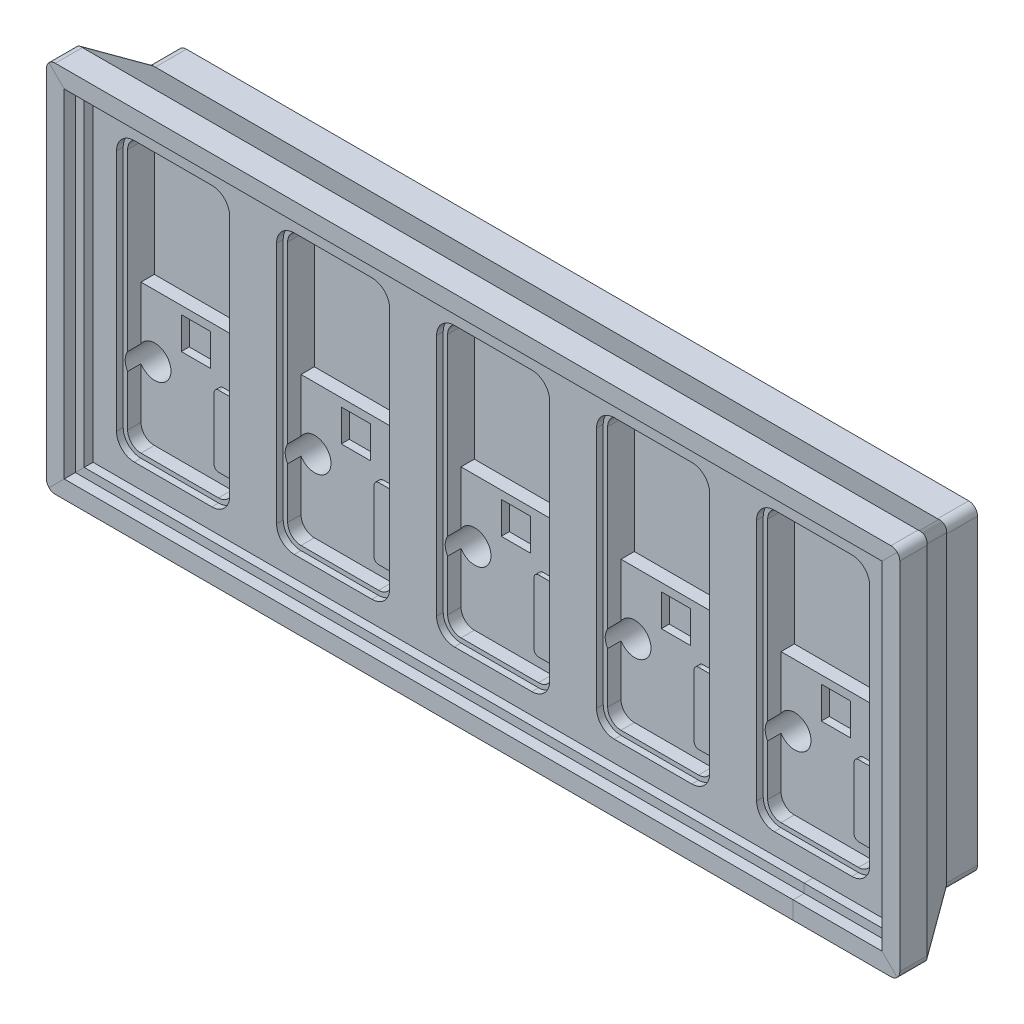
from build123d import *

# Parameters (mm, degrees)
SKIZZE1_W                         = 36
SKIZZE1_H                         = 72
AUFSATZ_LINEAR_AUSTRAGEN1_DEPTH   = 19
SCHNITT_LINEAR_AUSTRAGEN1_DEPTH   = 1.5
SCHNITT_LINEAR_AUSTRAGEN2_DEPTH   = 3
SCHNITT_LINEAR_AUSTRAGEN3_DEPTH   = 3
SKIZZE5_R                         = 3.65
SCHNITT_LINEAR_AUSTRAGEN4_DEPTH   = 15.5
SKIZZE6_W                         = 6.6
SKIZZE6_H                         = 7.2
SCHNITT_LINEAR_AUSTRAGEN5_DEPTH   = 4.8
SKIZZE7_W                         = 6
SKIZZE7_H                         = 16
AUFSATZ_LINEAR_AUSTRAGEN2_DEPTH   = 1
VERRUNDUNG2_R                     = 1
LINEARES_MUSTER3_COUNT            = 5
LINEARES_MUSTER3_PITCH            = 36
VERRUNDUNG2_OF_LINEARES_MUSTER3_R = 1
VERRUNDUNG3_R                     = 2


with BuildPart() as part:
    # Skizze1 → Aufsatz-Linear austragen1 (new body)
    with BuildSketch(Plane.XY):
        Rectangle(SKIZZE1_W, SKIZZE1_H)
    aufsatz_linear_austragen1 = extrude(amount=AUFSATZ_LINEAR_AUSTRAGEN1_DEPTH)

    # Skizze2 → Schnitt-Linear austragen1 (cut)
    with BuildSketch(Plane.XY.offset(19)):
        with BuildLine():
            Line((-8.725, -31.325), (8.725, -31.325))
            ThreePointArc((8.725, -31.325), (11.553427125, -30.153427125), (12.725, -27.325))
            Line((12.725, -27.325), (12.725, 27.325))
            ThreePointArc((12.725, 27.325), (11.553427125, 30.153427125), (8.725, 31.325))
            Line((8.725, 31.325), (-8.725, 31.325))
            ThreePointArc((-8.725, 31.325), (-11.553427125, 30.153427125), (-12.725, 27.325))
            Line((-12.725, 27.325), (-12.725, -27.325))
            ThreePointArc((-12.725, -27.325), (-11.553427125, -30.153427125), (-8.725, -31.325))
        make_face()
    schnitt_linear_austragen1 = extrude(amount=-SCHNITT_LINEAR_AUSTRAGEN1_DEPTH, mode=Mode.SUBTRACT)

    # Skizze3 → Schnitt-Linear austragen2 (cut)
    with BuildSketch(Plane.XY.offset(17.5)):
        with BuildLine():
            Line((-8.725, -30.325), (8.725, -30.325))
            ThreePointArc((8.725, -30.325), (10.846320344, -29.446320344), (11.725, -27.325))
            Line((11.725, -27.325), (11.725, 27.325))
            ThreePointArc((11.725, 27.325), (10.846320344, 29.446320344), (8.725, 30.325))
            Line((8.725, 30.325), (-8.725, 30.325))
            ThreePointArc((-8.725, 30.325), (-10.846320344, 29.446320344), (-11.725, 27.325))
            Line((-11.725, 27.325), (-11.725, -27.325))
            ThreePointArc((-11.725, -27.325), (-10.846320344, -29.446320344), (-8.725, -30.325))
        make_face()
    schnitt_linear_austragen2 = extrude(amount=-SCHNITT_LINEAR_AUSTRAGEN2_DEPTH, mode=Mode.SUBTRACT)

    # Skizze4 → Schnitt-Linear austragen3 (cut)
    with BuildSketch(Plane.XY.offset(14.5)):
        with BuildLine():
            Line((-11.725, 0), (11.725, 0))
            Line((11.725, 0), (11.725, 27.325))
            ThreePointArc((11.725, 27.325), (10.846320344, 29.446320344), (8.725, 30.325))
            Line((8.725, 30.325), (-8.725, 30.325))
            ThreePointArc((-8.725, 30.325), (-10.846320344, 29.446320344), (-11.725, 27.325))
            Line((-11.725, 27.325), (-11.725, 0))
        make_face()
    schnitt_linear_austragen3 = extrude(amount=-SCHNITT_LINEAR_AUSTRAGEN3_DEPTH, mode=Mode.SUBTRACT)

    # Skizze5 → Schnitt-Linear austragen4 (cut)
    with BuildSketch(Plane.XY.offset(17.5)):
        with Locations((-8.63, -13.97)):
            Circle(SKIZZE5_R)
    schnitt_linear_austragen4 = extrude(amount=-SCHNITT_LINEAR_AUSTRAGEN4_DEPTH, mode=Mode.SUBTRACT)

    # Skizze6 → Schnitt-Linear austragen5 (cut)
    with BuildSketch(Plane.XY.offset(17.5)):
        with Locations((0.64, -5.4)):
            Rectangle(SKIZZE6_W, SKIZZE6_H)
    schnitt_linear_austragen5 = extrude(amount=-SCHNITT_LINEAR_AUSTRAGEN5_DEPTH, mode=Mode.SUBTRACT)

    # Skizze7 → Aufsatz-Linear austragen2 (add)
    with BuildSketch(Plane.XY.offset(14.5)):
        with Locations((8.725, -19.325)):
            Rectangle(SKIZZE7_W, SKIZZE7_H)
    aufsatz_linear_austragen2 = extrude(amount=AUFSATZ_LINEAR_AUSTRAGEN2_DEPTH)

    # Verrundung2
    verrundung2_edges = [part.edges().sort_by_distance(p)[0] for p in [
        (11.725, -11.325, 15),
        (5.725, -11.325, 15),
        (5.725, -27.325, 15),
        (11.725, -27.325, 15),
    ]]
    fillet(verrundung2_edges, radius=VERRUNDUNG2_R)

    # Lineares Muster3: Aufsatz-Linear austragen1, Schnitt-Linear austragen1, Schnitt-Linear austragen2, Schnitt-Linear austragen3, Schnitt-Linear austragen4, Schnitt-Linear austragen5, Aufsatz-Linear austragen2 ×5
    with Locations(*[(-i * LINEARES_MUSTER3_PITCH, 0, 0) for i in range(1, LINEARES_MUSTER3_COUNT)]):
        add(aufsatz_linear_austragen1)
        add(schnitt_linear_austragen1, mode=Mode.SUBTRACT)
        add(schnitt_linear_austragen2, mode=Mode.SUBTRACT)
        add(schnitt_linear_austragen3, mode=Mode.SUBTRACT)
        add(schnitt_linear_austragen4, mode=Mode.SUBTRACT)
        add(schnitt_linear_austragen5, mode=Mode.SUBTRACT)
        add(aufsatz_linear_austragen2)

    # Verrundung2 of Lineares Muster3
    verrundung2_of_lineares_muster3_edges = [part.edges().sort_by_distance(p)[0] for p in [
        (-24.275, -11.325, 15),
        (-30.275, -11.325, 15),
        (-30.275, -27.325, 15),
        (-24.275, -27.325, 15),
        (-60.275, -11.325, 15),
        (-66.275, -11.325, 15),
        (-66.275, -27.325, 15),
        (-60.275, -27.325, 15),
        (-96.275, -11.325, 15),
        (-102.275, -11.325, 15),
        (-102.275, -27.325, 15),
        (-96.275, -27.325, 15),
        (-132.275, -11.325, 15),
        (-138.275, -11.325, 15),
        (-138.275, -27.325, 15),
        (-132.275, -27.325, 15),
    ]]
    fillet(verrundung2_of_lineares_muster3_edges, radius=VERRUNDUNG2_OF_LINEARES_MUSTER3_R)

    # Austragung1: sweep along a path in Skizze9
    with BuildLine(Plane.XY.offset(19)) as austragung1_path:
        Line((18, 36), (-162, 36))
        Line((-162, 36), (-162, -36))
        Line((-162, -36), (18, -36))
        Line((18, -36), (18, 36))
    # Skizze8 → Austragung1 (sweep)
    with BuildSketch(Plane(origin=(0, 0, 0), x_dir=(0, 0, -1), z_dir=(1, 0, 0))):
        Polygon((-7, -36), (-17.392304845, -42), (-23.5, -42), (-23.5, -38), (-21, -38), (-21, -36), (-19, -36), align=None)
    sweep(path=austragung1_path.line, transition=Transition.RIGHT)

    # Verrundung3
    # the kernel refuses this fillet: 2 mm, written as the material it takes off along each edge
    with BuildSketch(Plane(origin=(-162, -36, -5), x_dir=(0, 1, 0), z_dir=(0, 0, 1))) as verrundung3_piece_1_section:
        with BuildLine():
            CenterArc((VERRUNDUNG3_R, -VERRUNDUNG3_R), VERRUNDUNG3_R, 90, 90)
            Line((0, -VERRUNDUNG3_R), (0, 0))
            Line((0, 0), (VERRUNDUNG3_R, 0))
        make_face()
    verrundung3_piece_1 = extrude(amount=17, mode=Mode.PRIVATE)
    verrundung3_piece_1 = split(verrundung3_piece_1, bisect_by=Plane(origin=(-159.017907567, -35.559247483, 1.834864394), z_dir=(-0.8660254037844417, 0, -0.49999999999999484)), keep=Keep.TOP, mode=Mode.PRIVATE)
    verrundung3_piece_1 = split(verrundung3_piece_1, bisect_by=Plane(origin=(-161.559247483, -33.017907567, 1.834864394), z_dir=(0, -0.8660254037844418, -0.4999999999999947)), keep=Keep.TOP, mode=Mode.PRIVATE)
    add(verrundung3_piece_1, mode=Mode.SUBTRACT)
    with BuildSketch(Plane(origin=(-162, -36, -5), x_dir=(0, 1, 0), z_dir=(0, 0, 1))) as verrundung3_piece_2_section:
        with BuildLine():
            CenterArc((VERRUNDUNG3_R, -VERRUNDUNG3_R), VERRUNDUNG3_R, 90, 90)
            Line((0, -VERRUNDUNG3_R), (0, 0))
            Line((0, 0), (VERRUNDUNG3_R, 0))
        make_face()
    verrundung3_piece_2 = extrude(amount=17, mode=Mode.PRIVATE)
    verrundung3_piece_2 = split(verrundung3_piece_2, bisect_by=Plane(origin=(-161.306604123, -35.914036084, 5.799003111), z_dir=(0.8660254037844417, 0, 0.49999999999999484)), keep=Keep.TOP, mode=Mode.PRIVATE)
    verrundung3_piece_2 = split(verrundung3_piece_2, bisect_by=Plane(origin=(-160.942144946, -35.549576907, 6.219844318), z_dir=(0, -0.8660254037844418, -0.4999999999999947)), keep=Keep.TOP, mode=Mode.PRIVATE)
    add(verrundung3_piece_2, mode=Mode.SUBTRACT)
    with BuildSketch(Plane(origin=(-162, -36, -5), x_dir=(0, 1, 0), z_dir=(0, 0, 1))) as verrundung3_piece_3_section:
        with BuildLine():
            CenterArc((VERRUNDUNG3_R, -VERRUNDUNG3_R), VERRUNDUNG3_R, 90, 90)
            Line((0, -VERRUNDUNG3_R), (0, 0))
            Line((0, 0), (VERRUNDUNG3_R, 0))
        make_face()
    verrundung3_piece_3 = extrude(amount=17, mode=Mode.PRIVATE)
    verrundung3_piece_3 = split(verrundung3_piece_3, bisect_by=Plane(origin=(-161.549576907, -34.942144946, 6.219844318), z_dir=(-0.8660254037844417, 0, -0.49999999999999484)), keep=Keep.TOP, mode=Mode.PRIVATE)
    verrundung3_piece_3 = split(verrundung3_piece_3, bisect_by=Plane(origin=(-161.914036084, -35.306604123, 5.799003111), z_dir=(0, 0.8660254037844418, 0.4999999999999947)), keep=Keep.TOP, mode=Mode.PRIVATE)
    add(verrundung3_piece_3, mode=Mode.SUBTRACT)
    with BuildSketch(Plane(origin=(-162, 36, -5), x_dir=(1, 0, 0), z_dir=(0, 0, 1))) as verrundung3_piece_4_section:
        with BuildLine():
            CenterArc((VERRUNDUNG3_R, -VERRUNDUNG3_R), VERRUNDUNG3_R, 90, 90)
            Line((0, -VERRUNDUNG3_R), (0, 0))
            Line((0, 0), (VERRUNDUNG3_R, 0))
        make_face()
    verrundung3_piece_4 = extrude(amount=17, mode=Mode.PRIVATE)
    verrundung3_piece_4 = split(verrundung3_piece_4, bisect_by=Plane(origin=(-161.559247483, 33.017907567, 1.834864394), z_dir=(0, 0.8660254037844417, -0.49999999999999484)), keep=Keep.TOP, mode=Mode.PRIVATE)
    verrundung3_piece_4 = split(verrundung3_piece_4, bisect_by=Plane(origin=(-159.017907567, 35.559247483, 1.834864394), z_dir=(-0.8660254037844417, 0, -0.49999999999999484)), keep=Keep.TOP, mode=Mode.PRIVATE)
    add(verrundung3_piece_4, mode=Mode.SUBTRACT)
    with BuildSketch(Plane(origin=(-162, 36, -5), x_dir=(1, 0, 0), z_dir=(0, 0, 1))) as verrundung3_piece_5_section:
        with BuildLine():
            CenterArc((VERRUNDUNG3_R, -VERRUNDUNG3_R), VERRUNDUNG3_R, 90, 90)
            Line((0, -VERRUNDUNG3_R), (0, 0))
            Line((0, 0), (VERRUNDUNG3_R, 0))
        make_face()
    verrundung3_piece_5 = extrude(amount=17, mode=Mode.PRIVATE)
    verrundung3_piece_5 = split(verrundung3_piece_5, bisect_by=Plane(origin=(-161.914036084, 35.306604123, 5.799003111), z_dir=(0, -0.8660254037844417, 0.49999999999999484)), keep=Keep.TOP, mode=Mode.PRIVATE)
    verrundung3_piece_5 = split(verrundung3_piece_5, bisect_by=Plane(origin=(-161.549576907, 34.942144946, 6.219844318), z_dir=(-0.8660254037844417, 0, -0.49999999999999484)), keep=Keep.TOP, mode=Mode.PRIVATE)
    add(verrundung3_piece_5, mode=Mode.SUBTRACT)
    with BuildSketch(Plane(origin=(-162, 36, -5), x_dir=(1, 0, 0), z_dir=(0, 0, 1))) as verrundung3_piece_6_section:
        with BuildLine():
            CenterArc((VERRUNDUNG3_R, -VERRUNDUNG3_R), VERRUNDUNG3_R, 90, 90)
            Line((0, -VERRUNDUNG3_R), (0, 0))
            Line((0, 0), (VERRUNDUNG3_R, 0))
        make_face()
    verrundung3_piece_6 = extrude(amount=17, mode=Mode.PRIVATE)
    verrundung3_piece_6 = split(verrundung3_piece_6, bisect_by=Plane(origin=(-160.942144946, 35.549576907, 6.219844318), z_dir=(0, 0.8660254037844417, -0.49999999999999484)), keep=Keep.TOP, mode=Mode.PRIVATE)
    verrundung3_piece_6 = split(verrundung3_piece_6, bisect_by=Plane(origin=(-161.306604123, 35.914036084, 5.799003111), z_dir=(0.8660254037844417, 0, 0.49999999999999484)), keep=Keep.TOP, mode=Mode.PRIVATE)
    add(verrundung3_piece_6, mode=Mode.SUBTRACT)
    with BuildSketch(Plane(origin=(18, 36, -5), x_dir=(-1, 0, 0), z_dir=(0, 0, 1))) as verrundung3_piece_7_section:
        with BuildLine():
            CenterArc((VERRUNDUNG3_R, VERRUNDUNG3_R), VERRUNDUNG3_R, 180, 90)
            Line((0, VERRUNDUNG3_R), (0, 0))
            Line((0, 0), (VERRUNDUNG3_R, 0))
        make_face()
    verrundung3_piece_7 = extrude(amount=17, mode=Mode.PRIVATE)
    verrundung3_piece_7 = split(verrundung3_piece_7, bisect_by=Plane(origin=(17.559247483, 33.017907567, 1.834864394), z_dir=(0, 0.8660254037844417, -0.49999999999999484)), keep=Keep.TOP, mode=Mode.PRIVATE)
    verrundung3_piece_7 = split(verrundung3_piece_7, bisect_by=Plane(origin=(15.017907567, 35.559247483, 1.834864394), z_dir=(0.8660254037844418, 0, -0.4999999999999947)), keep=Keep.TOP, mode=Mode.PRIVATE)
    add(verrundung3_piece_7, mode=Mode.SUBTRACT)
    with BuildSketch(Plane(origin=(18, 36, -5), x_dir=(-1, 0, 0), z_dir=(0, 0, 1))) as verrundung3_piece_8_section:
        with BuildLine():
            CenterArc((VERRUNDUNG3_R, VERRUNDUNG3_R), VERRUNDUNG3_R, 180, 90)
            Line((0, VERRUNDUNG3_R), (0, 0))
            Line((0, 0), (VERRUNDUNG3_R, 0))
        make_face()
    verrundung3_piece_8 = extrude(amount=17, mode=Mode.PRIVATE)
    verrundung3_piece_8 = split(verrundung3_piece_8, bisect_by=Plane(origin=(17.914036084, 35.306604123, 5.799003111), z_dir=(0, -0.8660254037844417, 0.49999999999999484)), keep=Keep.TOP, mode=Mode.PRIVATE)
    verrundung3_piece_8 = split(verrundung3_piece_8, bisect_by=Plane(origin=(17.549576907, 34.942144946, 6.219844318), z_dir=(0.8660254037844418, 0, -0.4999999999999947)), keep=Keep.TOP, mode=Mode.PRIVATE)
    add(verrundung3_piece_8, mode=Mode.SUBTRACT)
    with BuildSketch(Plane(origin=(18, 36, -5), x_dir=(-1, 0, 0), z_dir=(0, 0, 1))) as verrundung3_piece_9_section:
        with BuildLine():
            CenterArc((VERRUNDUNG3_R, VERRUNDUNG3_R), VERRUNDUNG3_R, 180, 90)
            Line((0, VERRUNDUNG3_R), (0, 0))
            Line((0, 0), (VERRUNDUNG3_R, 0))
        make_face()
    verrundung3_piece_9 = extrude(amount=17, mode=Mode.PRIVATE)
    verrundung3_piece_9 = split(verrundung3_piece_9, bisect_by=Plane(origin=(16.942144946, 35.549576907, 6.219844318), z_dir=(0, 0.8660254037844417, -0.49999999999999484)), keep=Keep.TOP, mode=Mode.PRIVATE)
    verrundung3_piece_9 = split(verrundung3_piece_9, bisect_by=Plane(origin=(17.306604123, 35.914036084, 5.799003111), z_dir=(-0.8660254037844418, 0, 0.4999999999999947)), keep=Keep.TOP, mode=Mode.PRIVATE)
    add(verrundung3_piece_9, mode=Mode.SUBTRACT)
    with BuildSketch(Plane(origin=(18, -36, -5), x_dir=(-1, 0, 0), z_dir=(0, 0, 1))) as verrundung3_piece_10_section:
        with BuildLine():
            CenterArc((VERRUNDUNG3_R, -VERRUNDUNG3_R), VERRUNDUNG3_R, 90, 90)
            Line((0, -VERRUNDUNG3_R), (0, 0))
            Line((0, 0), (VERRUNDUNG3_R, 0))
        make_face()
    verrundung3_piece_10 = extrude(amount=17, mode=Mode.PRIVATE)
    verrundung3_piece_10 = split(verrundung3_piece_10, bisect_by=Plane(origin=(17.559247483, -33.017907567, 1.834864394), z_dir=(0, -0.8660254037844418, -0.4999999999999947)), keep=Keep.TOP, mode=Mode.PRIVATE)
    verrundung3_piece_10 = split(verrundung3_piece_10, bisect_by=Plane(origin=(15.017907567, -35.559247483, 1.834864394), z_dir=(0.8660254037844418, 0, -0.4999999999999947)), keep=Keep.TOP, mode=Mode.PRIVATE)
    add(verrundung3_piece_10, mode=Mode.SUBTRACT)
    with BuildSketch(Plane(origin=(18, -36, -5), x_dir=(-1, 0, 0), z_dir=(0, 0, 1))) as verrundung3_piece_11_section:
        with BuildLine():
            CenterArc((VERRUNDUNG3_R, -VERRUNDUNG3_R), VERRUNDUNG3_R, 90, 90)
            Line((0, -VERRUNDUNG3_R), (0, 0))
            Line((0, 0), (VERRUNDUNG3_R, 0))
        make_face()
    verrundung3_piece_11 = extrude(amount=17, mode=Mode.PRIVATE)
    verrundung3_piece_11 = split(verrundung3_piece_11, bisect_by=Plane(origin=(17.914036084, -35.306604123, 5.799003111), z_dir=(0, 0.8660254037844418, 0.4999999999999947)), keep=Keep.TOP, mode=Mode.PRIVATE)
    verrundung3_piece_11 = split(verrundung3_piece_11, bisect_by=Plane(origin=(17.549576907, -34.942144946, 6.219844318), z_dir=(0.8660254037844418, 0, -0.4999999999999947)), keep=Keep.TOP, mode=Mode.PRIVATE)
    add(verrundung3_piece_11, mode=Mode.SUBTRACT)
    with BuildSketch(Plane(origin=(18, -36, -5), x_dir=(-1, 0, 0), z_dir=(0, 0, 1))) as verrundung3_piece_12_section:
        with BuildLine():
            CenterArc((VERRUNDUNG3_R, -VERRUNDUNG3_R), VERRUNDUNG3_R, 90, 90)
            Line((0, -VERRUNDUNG3_R), (0, 0))
            Line((0, 0), (VERRUNDUNG3_R, 0))
        make_face()
    verrundung3_piece_12 = extrude(amount=17, mode=Mode.PRIVATE)
    verrundung3_piece_12 = split(verrundung3_piece_12, bisect_by=Plane(origin=(16.942144946, -35.549576907, 6.219844318), z_dir=(0, -0.8660254037844418, -0.4999999999999947)), keep=Keep.TOP, mode=Mode.PRIVATE)
    verrundung3_piece_12 = split(verrundung3_piece_12, bisect_by=Plane(origin=(17.306604123, -35.914036084, 5.799003111), z_dir=(-0.8660254037844418, 0, 0.4999999999999947)), keep=Keep.TOP, mode=Mode.PRIVATE)
    add(verrundung3_piece_12, mode=Mode.SUBTRACT)
    with BuildSketch(Plane(origin=(-160.267949192, -34.267949192, 4), x_dir=(-0.22360679774997086, 0.8944271909999177, 0.38729833462074187), z_dir=(-0.4472135954999542, -0.4472135954999541, 0.7745966692414877))) as verrundung3_piece_13_section:
        with BuildLine():
            CenterArc((VERRUNDUNG3_R * 0.774596669241, -VERRUNDUNG3_R), VERRUNDUNG3_R, 90, 75.522487814)
            Line((-VERRUNDUNG3_R * 0.19364916731, -VERRUNDUNG3_R * 0.75), (0, 0))
            Line((0, 0), (VERRUNDUNG3_R * 0.774596669241, 0))
        make_face()
    verrundung3_piece_13 = extrude(amount=21.162374557, mode=Mode.PRIVATE)
    verrundung3_piece_13 = split(verrundung3_piece_13, bisect_by=Plane(origin=(-162, -36.435199935, 7.854302983), z_dir=(1, 0, 0)), keep=Keep.TOP, mode=Mode.PRIVATE)
    verrundung3_piece_13 = split(verrundung3_piece_13, bisect_by=Plane(origin=(-161.564800065, -36, 7.854302983), z_dir=(0, -1, 0)), keep=Keep.TOP, mode=Mode.PRIVATE)
    add(verrundung3_piece_13, mode=Mode.SUBTRACT)
    with BuildSketch(Plane(origin=(-160.267949192, -34.267949192, 4), x_dir=(-0.22360679774997086, 0.8944271909999177, 0.38729833462074187), z_dir=(-0.4472135954999542, -0.4472135954999541, 0.7745966692414877))) as verrundung3_piece_14_section:
        with BuildLine():
            CenterArc((VERRUNDUNG3_R * 0.774596669241, -VERRUNDUNG3_R), VERRUNDUNG3_R, 90, 75.522487814)
            Line((-VERRUNDUNG3_R * 0.19364916731, -VERRUNDUNG3_R * 0.75), (0, 0))
            Line((0, 0), (VERRUNDUNG3_R * 0.774596669241, 0))
        make_face()
    verrundung3_piece_14 = extrude(amount=21.162374557, mode=Mode.PRIVATE)
    verrundung3_piece_14 = split(verrundung3_piece_14, bisect_by=Plane(origin=(-162, -35.564800065, 7.854302983), z_dir=(-1, 0, 0)), keep=Keep.TOP, mode=Mode.PRIVATE)
    verrundung3_piece_14 = split(verrundung3_piece_14, bisect_by=Plane(origin=(-162.435199935, -36, 7.854302983), z_dir=(0, 1, 0)), keep=Keep.TOP, mode=Mode.PRIVATE)
    add(verrundung3_piece_14, mode=Mode.SUBTRACT)
    with BuildSketch(Plane(origin=(-160.267949192, -34.267949192, 4), x_dir=(-0.22360679774997086, 0.8944271909999177, 0.38729833462074187), z_dir=(-0.4472135954999542, -0.4472135954999541, 0.7745966692414877))) as verrundung3_piece_15_section:
        with BuildLine():
            CenterArc((VERRUNDUNG3_R * 0.774596669241, -VERRUNDUNG3_R), VERRUNDUNG3_R, 90, 75.522487814)
            Line((-VERRUNDUNG3_R * 0.19364916731, -VERRUNDUNG3_R * 0.75), (0, 0))
            Line((0, 0), (VERRUNDUNG3_R * 0.774596669241, 0))
        make_face()
    verrundung3_piece_15 = extrude(amount=21.162374557, mode=Mode.PRIVATE)
    verrundung3_piece_15 = split(verrundung3_piece_15, bisect_by=Plane(origin=(-162, -39.884588161, 14.379459867), z_dir=(-1, 0, 0)), keep=Keep.TOP, mode=Mode.PRIVATE)
    verrundung3_piece_15 = split(verrundung3_piece_15, bisect_by=Plane(origin=(-165.884588161, -36, 14.379459867), z_dir=(0, -1, 0)), keep=Keep.TOP, mode=Mode.PRIVATE)
    add(verrundung3_piece_15, mode=Mode.SUBTRACT)
    with BuildSketch(Plane(origin=(-168, -42, 12.392304845), x_dir=(0, 1, 0), z_dir=(0, 0, 1)), Plane(origin=(24, -42, 12.392304845), x_dir=(-1, 0, 0), z_dir=(0, 0, 1)), Plane(origin=(-168, 42, 12.392304845), x_dir=(1, 0, 0), z_dir=(0, 0, 1))) as verrundung3_piece_16:
        with BuildLine():
            CenterArc((VERRUNDUNG3_R, -VERRUNDUNG3_R), VERRUNDUNG3_R, 90, 90)
            Line((0, -VERRUNDUNG3_R), (0, 0))
            Line((0, 0), (VERRUNDUNG3_R, 0))
        make_face()
    extrude(amount=16.107695155, mode=Mode.SUBTRACT)
    with BuildSketch(Plane(origin=(16.267949192, -34.267949192, 4), x_dir=(-0.8944271909999179, -0.22360679774997566, 0.38729833462073926), z_dir=(0.44721359549995415, -0.44721359549995415, 0.7745966692414877))) as verrundung3_piece_17_section:
        with BuildLine():
            CenterArc((VERRUNDUNG3_R * 0.774596669241, -VERRUNDUNG3_R), VERRUNDUNG3_R, 90, 75.522487814)
            Line((-VERRUNDUNG3_R * 0.19364916731, -VERRUNDUNG3_R * 0.75), (0, 0))
            Line((0, 0), (VERRUNDUNG3_R * 0.774596669241, 0))
        make_face()
    verrundung3_piece_17 = extrude(amount=21.162374557, mode=Mode.PRIVATE)
    verrundung3_piece_17 = split(verrundung3_piece_17, bisect_by=Plane(origin=(18.435199935, -36, 7.854302983), z_dir=(0, 1, 0)), keep=Keep.TOP, mode=Mode.PRIVATE)
    verrundung3_piece_17 = split(verrundung3_piece_17, bisect_by=Plane(origin=(18, -35.564800065, 7.854302983), z_dir=(1, 0, 0)), keep=Keep.TOP, mode=Mode.PRIVATE)
    add(verrundung3_piece_17, mode=Mode.SUBTRACT)
    with BuildSketch(Plane(origin=(16.267949192, -34.267949192, 4), x_dir=(-0.8944271909999179, -0.22360679774997566, 0.38729833462073926), z_dir=(0.44721359549995415, -0.44721359549995415, 0.7745966692414877))) as verrundung3_piece_18_section:
        with BuildLine():
            CenterArc((VERRUNDUNG3_R * 0.774596669241, -VERRUNDUNG3_R), VERRUNDUNG3_R, 90, 75.522487814)
            Line((-VERRUNDUNG3_R * 0.19364916731, -VERRUNDUNG3_R * 0.75), (0, 0))
            Line((0, 0), (VERRUNDUNG3_R * 0.774596669241, 0))
        make_face()
    verrundung3_piece_18 = extrude(amount=21.162374557, mode=Mode.PRIVATE)
    verrundung3_piece_18 = split(verrundung3_piece_18, bisect_by=Plane(origin=(17.564800065, -36, 7.854302983), z_dir=(0, -1, 0)), keep=Keep.TOP, mode=Mode.PRIVATE)
    verrundung3_piece_18 = split(verrundung3_piece_18, bisect_by=Plane(origin=(18, -36.435199935, 7.854302983), z_dir=(-1, 0, 0)), keep=Keep.TOP, mode=Mode.PRIVATE)
    add(verrundung3_piece_18, mode=Mode.SUBTRACT)
    with BuildSketch(Plane(origin=(16.267949192, -34.267949192, 4), x_dir=(-0.8944271909999179, -0.22360679774997566, 0.38729833462073926), z_dir=(0.44721359549995415, -0.44721359549995415, 0.7745966692414877))) as verrundung3_piece_19_section:
        with BuildLine():
            CenterArc((VERRUNDUNG3_R * 0.774596669241, -VERRUNDUNG3_R), VERRUNDUNG3_R, 90, 75.522487814)
            Line((-VERRUNDUNG3_R * 0.19364916731, -VERRUNDUNG3_R * 0.75), (0, 0))
            Line((0, 0), (VERRUNDUNG3_R * 0.774596669241, 0))
        make_face()
    verrundung3_piece_19 = extrude(amount=21.162374557, mode=Mode.PRIVATE)
    verrundung3_piece_19 = split(verrundung3_piece_19, bisect_by=Plane(origin=(21.884588161, -36, 14.379459867), z_dir=(0, -1, 0)), keep=Keep.TOP, mode=Mode.PRIVATE)
    verrundung3_piece_19 = split(verrundung3_piece_19, bisect_by=Plane(origin=(18, -39.884588161, 14.379459867), z_dir=(1, 0, 0)), keep=Keep.TOP, mode=Mode.PRIVATE)
    add(verrundung3_piece_19, mode=Mode.SUBTRACT)
    with BuildSketch(Plane(origin=(-160.267949192, 34.267949192, 4), x_dir=(0.8944271909999177, 0.22360679774997283, 0.38729833462074087), z_dir=(-0.4472135954999542, 0.4472135954999542, 0.7745966692414877))) as verrundung3_piece_20_section:
        with BuildLine():
            CenterArc((VERRUNDUNG3_R * 0.774596669241, -VERRUNDUNG3_R), VERRUNDUNG3_R, 90, 75.522487814)
            Line((-VERRUNDUNG3_R * 0.19364916731, -VERRUNDUNG3_R * 0.75), (0, 0))
            Line((0, 0), (VERRUNDUNG3_R * 0.774596669241, 0))
        make_face()
    verrundung3_piece_20 = extrude(amount=21.162374557, mode=Mode.PRIVATE)
    verrundung3_piece_20 = split(verrundung3_piece_20, bisect_by=Plane(origin=(-162.435199935, 36, 7.854302983), z_dir=(0, -1, 0)), keep=Keep.TOP, mode=Mode.PRIVATE)
    verrundung3_piece_20 = split(verrundung3_piece_20, bisect_by=Plane(origin=(-162, 35.564800065, 7.854302983), z_dir=(-1, 0, 0)), keep=Keep.TOP, mode=Mode.PRIVATE)
    add(verrundung3_piece_20, mode=Mode.SUBTRACT)
    with BuildSketch(Plane(origin=(-160.267949192, 34.267949192, 4), x_dir=(0.8944271909999177, 0.22360679774997283, 0.38729833462074087), z_dir=(-0.4472135954999542, 0.4472135954999542, 0.7745966692414877))) as verrundung3_piece_21_section:
        with BuildLine():
            CenterArc((VERRUNDUNG3_R * 0.774596669241, -VERRUNDUNG3_R), VERRUNDUNG3_R, 90, 75.522487814)
            Line((-VERRUNDUNG3_R * 0.19364916731, -VERRUNDUNG3_R * 0.75), (0, 0))
            Line((0, 0), (VERRUNDUNG3_R * 0.774596669241, 0))
        make_face()
    verrundung3_piece_21 = extrude(amount=21.162374557, mode=Mode.PRIVATE)
    verrundung3_piece_21 = split(verrundung3_piece_21, bisect_by=Plane(origin=(-161.564800065, 36, 7.854302983), z_dir=(0, 1, 0)), keep=Keep.TOP, mode=Mode.PRIVATE)
    verrundung3_piece_21 = split(verrundung3_piece_21, bisect_by=Plane(origin=(-162, 36.435199935, 7.854302983), z_dir=(1, 0, 0)), keep=Keep.TOP, mode=Mode.PRIVATE)
    add(verrundung3_piece_21, mode=Mode.SUBTRACT)
    with BuildSketch(Plane(origin=(-160.267949192, 34.267949192, 4), x_dir=(0.8944271909999177, 0.22360679774997283, 0.38729833462074087), z_dir=(-0.4472135954999542, 0.4472135954999542, 0.7745966692414877))) as verrundung3_piece_22_section:
        with BuildLine():
            CenterArc((VERRUNDUNG3_R * 0.774596669241, -VERRUNDUNG3_R), VERRUNDUNG3_R, 90, 75.522487814)
            Line((-VERRUNDUNG3_R * 0.19364916731, -VERRUNDUNG3_R * 0.75), (0, 0))
            Line((0, 0), (VERRUNDUNG3_R * 0.774596669241, 0))
        make_face()
    verrundung3_piece_22 = extrude(amount=21.162374557, mode=Mode.PRIVATE)
    verrundung3_piece_22 = split(verrundung3_piece_22, bisect_by=Plane(origin=(-165.884588161, 36, 14.379459867), z_dir=(0, 1, 0)), keep=Keep.TOP, mode=Mode.PRIVATE)
    verrundung3_piece_22 = split(verrundung3_piece_22, bisect_by=Plane(origin=(-162, 39.884588161, 14.379459867), z_dir=(-1, 0, 0)), keep=Keep.TOP, mode=Mode.PRIVATE)
    add(verrundung3_piece_22, mode=Mode.SUBTRACT)
    with BuildSketch(Plane(origin=(16.267949192, 34.267949192, 4), x_dir=(-0.8944271909999177, 0.223606797749976, 0.3872983346207389), z_dir=(0.4472135954999541, 0.4472135954999542, 0.7745966692414877))) as verrundung3_piece_23_section:
        with BuildLine():
            CenterArc((VERRUNDUNG3_R * 0.774596669241, VERRUNDUNG3_R), VERRUNDUNG3_R, 194.477512186, 75.522487814)
            Line((-VERRUNDUNG3_R * 0.19364916731, VERRUNDUNG3_R * 0.75), (0, 0))
            Line((0, 0), (VERRUNDUNG3_R * 0.774596669241, 0))
        make_face()
    verrundung3_piece_23 = extrude(amount=21.162374557, mode=Mode.PRIVATE)
    verrundung3_piece_23 = split(verrundung3_piece_23, bisect_by=Plane(origin=(18.435199935, 36, 7.854302983), z_dir=(0, -1, 0)), keep=Keep.TOP, mode=Mode.PRIVATE)
    verrundung3_piece_23 = split(verrundung3_piece_23, bisect_by=Plane(origin=(18, 35.564800065, 7.854302983), z_dir=(1, 0, 0)), keep=Keep.TOP, mode=Mode.PRIVATE)
    add(verrundung3_piece_23, mode=Mode.SUBTRACT)
    with BuildSketch(Plane(origin=(16.267949192, 34.267949192, 4), x_dir=(-0.8944271909999177, 0.223606797749976, 0.3872983346207389), z_dir=(0.4472135954999541, 0.4472135954999542, 0.7745966692414877))) as verrundung3_piece_24_section:
        with BuildLine():
            CenterArc((VERRUNDUNG3_R * 0.774596669241, VERRUNDUNG3_R), VERRUNDUNG3_R, 194.477512186, 75.522487814)
            Line((-VERRUNDUNG3_R * 0.19364916731, VERRUNDUNG3_R * 0.75), (0, 0))
            Line((0, 0), (VERRUNDUNG3_R * 0.774596669241, 0))
        make_face()
    verrundung3_piece_24 = extrude(amount=21.162374557, mode=Mode.PRIVATE)
    verrundung3_piece_24 = split(verrundung3_piece_24, bisect_by=Plane(origin=(17.564800065, 36, 7.854302983), z_dir=(0, 1, 0)), keep=Keep.TOP, mode=Mode.PRIVATE)
    verrundung3_piece_24 = split(verrundung3_piece_24, bisect_by=Plane(origin=(18, 36.435199935, 7.854302983), z_dir=(-1, 0, 0)), keep=Keep.TOP, mode=Mode.PRIVATE)
    add(verrundung3_piece_24, mode=Mode.SUBTRACT)
    with BuildSketch(Plane(origin=(16.267949192, 34.267949192, 4), x_dir=(-0.8944271909999177, 0.223606797749976, 0.3872983346207389), z_dir=(0.4472135954999541, 0.4472135954999542, 0.7745966692414877))) as verrundung3_piece_25_section:
        with BuildLine():
            CenterArc((VERRUNDUNG3_R * 0.774596669241, VERRUNDUNG3_R), VERRUNDUNG3_R, 194.477512186, 75.522487814)
            Line((-VERRUNDUNG3_R * 0.19364916731, VERRUNDUNG3_R * 0.75), (0, 0))
            Line((0, 0), (VERRUNDUNG3_R * 0.774596669241, 0))
        make_face()
    verrundung3_piece_25 = extrude(amount=21.162374557, mode=Mode.PRIVATE)
    verrundung3_piece_25 = split(verrundung3_piece_25, bisect_by=Plane(origin=(21.884588161, 36, 14.379459867), z_dir=(0, 1, 0)), keep=Keep.TOP, mode=Mode.PRIVATE)
    verrundung3_piece_25 = split(verrundung3_piece_25, bisect_by=Plane(origin=(18, 39.884588161, 14.379459867), z_dir=(1, 0, 0)), keep=Keep.TOP, mode=Mode.PRIVATE)
    add(verrundung3_piece_25, mode=Mode.SUBTRACT)
    with BuildSketch(Plane(origin=(24, 42, 12.392304845), x_dir=(-1, 0, 0), z_dir=(0, 0, 1))) as verrundung3_piece_26:
        with BuildLine():
            CenterArc((VERRUNDUNG3_R, VERRUNDUNG3_R), VERRUNDUNG3_R, 180, 90)
            Line((0, VERRUNDUNG3_R), (0, 0))
            Line((0, 0), (VERRUNDUNG3_R, 0))
        make_face()
    extrude(amount=16.107695155, mode=Mode.SUBTRACT)
    with BuildSketch(Plane(origin=(-160.267949192, -34.267949192, 4), x_dir=(-0.22360679774997086, 0.8944271909999177, 0.38729833462074187), z_dir=(-0.4472135954999542, -0.4472135954999541, 0.7745966692414877))) as verrundung3_piece_27a_section:
        with BuildLine():
            CenterArc((VERRUNDUNG3_R * 0.774596669241, -VERRUNDUNG3_R), VERRUNDUNG3_R, 90, 75.522487814)
            Line((-VERRUNDUNG3_R * 0.19364916731, -VERRUNDUNG3_R * 0.75), (0, 0))
            Line((0, 0), (VERRUNDUNG3_R * 0.774596669241, 0))
        make_face()
    verrundung3_piece_27a = extrude(amount=21.162374557, mode=Mode.PRIVATE)
    verrundung3_piece_27a = split(verrundung3_piece_27a, bisect_by=Plane(origin=(-162, -34.893449501, 5.733982181), z_dir=(1, 0, 0)), keep=Keep.TOP, mode=Mode.PRIVATE)
    verrundung3_piece_27a = split(verrundung3_piece_27a, bisect_by=Plane(origin=(-160.893449501, -36, 5.733982181), z_dir=(0, 1, 0)), keep=Keep.TOP, mode=Mode.PRIVATE)
    with BuildSketch(Plane(origin=(-162, -36, -5), x_dir=(0, 1, 0), z_dir=(0, 0, 1))) as verrundung3_piece_27b_section:
        with BuildLine():
            CenterArc((VERRUNDUNG3_R, -VERRUNDUNG3_R), VERRUNDUNG3_R, 90, 90)
            Line((0, -VERRUNDUNG3_R), (0, 0))
            Line((0, 0), (VERRUNDUNG3_R, 0))
        make_face()
    verrundung3_piece_27b = extrude(amount=17, mode=Mode.PRIVATE)
    verrundung3_piece_27b = split(verrundung3_piece_27b, bisect_by=Plane(origin=(-162.910924891, -35.546618893, 8.577768194), z_dir=(0.8660254037844417, 0, 0.49999999999999484)), keep=Keep.TOP, mode=Mode.PRIVATE)
    verrundung3_piece_27b = split(verrundung3_piece_27b, bisect_by=Plane(origin=(-161.546618893, -36.910924891, 8.577768194), z_dir=(0, 0.8660254037844418, 0.4999999999999947)), keep=Keep.TOP, mode=Mode.PRIVATE)
    verrundung3_piece_27 = verrundung3_piece_27a & verrundung3_piece_27b
    add(verrundung3_piece_27, mode=Mode.SUBTRACT)
    with BuildSketch(Plane(origin=(-160.267949192, 34.267949192, 4), x_dir=(0.8944271909999177, 0.22360679774997283, 0.38729833462074087), z_dir=(-0.4472135954999542, 0.4472135954999542, 0.7745966692414877))) as verrundung3_piece_28a_section:
        with BuildLine():
            CenterArc((VERRUNDUNG3_R * 0.774596669241, -VERRUNDUNG3_R), VERRUNDUNG3_R, 90, 75.522487814)
            Line((-VERRUNDUNG3_R * 0.19364916731, -VERRUNDUNG3_R * 0.75), (0, 0))
            Line((0, 0), (VERRUNDUNG3_R * 0.774596669241, 0))
        make_face()
    verrundung3_piece_28a = extrude(amount=21.162374557, mode=Mode.PRIVATE)
    verrundung3_piece_28a = split(verrundung3_piece_28a, bisect_by=Plane(origin=(-160.893449501, 36, 5.733982181), z_dir=(0, -1, 0)), keep=Keep.TOP, mode=Mode.PRIVATE)
    verrundung3_piece_28a = split(verrundung3_piece_28a, bisect_by=Plane(origin=(-162, 34.893449501, 5.733982181), z_dir=(1, 0, 0)), keep=Keep.TOP, mode=Mode.PRIVATE)
    with BuildSketch(Plane(origin=(-162, 36, -5), x_dir=(1, 0, 0), z_dir=(0, 0, 1))) as verrundung3_piece_28b_section:
        with BuildLine():
            CenterArc((VERRUNDUNG3_R, -VERRUNDUNG3_R), VERRUNDUNG3_R, 90, 90)
            Line((0, -VERRUNDUNG3_R), (0, 0))
            Line((0, 0), (VERRUNDUNG3_R, 0))
        make_face()
    verrundung3_piece_28b = extrude(amount=17, mode=Mode.PRIVATE)
    verrundung3_piece_28b = split(verrundung3_piece_28b, bisect_by=Plane(origin=(-161.546618893, 36.910924891, 8.577768194), z_dir=(0, -0.8660254037844417, 0.49999999999999484)), keep=Keep.TOP, mode=Mode.PRIVATE)
    verrundung3_piece_28b = split(verrundung3_piece_28b, bisect_by=Plane(origin=(-162.910924891, 35.546618893, 8.577768194), z_dir=(0.8660254037844417, 0, 0.49999999999999484)), keep=Keep.TOP, mode=Mode.PRIVATE)
    verrundung3_piece_28 = verrundung3_piece_28a & verrundung3_piece_28b
    add(verrundung3_piece_28, mode=Mode.SUBTRACT)
    with BuildSketch(Plane(origin=(16.267949192, 34.267949192, 4), x_dir=(-0.8944271909999177, 0.223606797749976, 0.3872983346207389), z_dir=(0.4472135954999541, 0.4472135954999542, 0.7745966692414877))) as verrundung3_piece_29a_section:
        with BuildLine():
            CenterArc((VERRUNDUNG3_R * 0.774596669241, VERRUNDUNG3_R), VERRUNDUNG3_R, 194.477512186, 75.522487814)
            Line((-VERRUNDUNG3_R * 0.19364916731, VERRUNDUNG3_R * 0.75), (0, 0))
            Line((0, 0), (VERRUNDUNG3_R * 0.774596669241, 0))
        make_face()
    verrundung3_piece_29a = extrude(amount=21.162374557, mode=Mode.PRIVATE)
    verrundung3_piece_29a = split(verrundung3_piece_29a, bisect_by=Plane(origin=(16.893449501, 36, 5.733982181), z_dir=(0, -1, 0)), keep=Keep.TOP, mode=Mode.PRIVATE)
    verrundung3_piece_29a = split(verrundung3_piece_29a, bisect_by=Plane(origin=(18, 34.893449501, 5.733982181), z_dir=(-1, 0, 0)), keep=Keep.TOP, mode=Mode.PRIVATE)
    with BuildSketch(Plane(origin=(18, 36, -5), x_dir=(-1, 0, 0), z_dir=(0, 0, 1))) as verrundung3_piece_29b_section:
        with BuildLine():
            CenterArc((VERRUNDUNG3_R, VERRUNDUNG3_R), VERRUNDUNG3_R, 180, 90)
            Line((0, VERRUNDUNG3_R), (0, 0))
            Line((0, 0), (VERRUNDUNG3_R, 0))
        make_face()
    verrundung3_piece_29b = extrude(amount=17, mode=Mode.PRIVATE)
    verrundung3_piece_29b = split(verrundung3_piece_29b, bisect_by=Plane(origin=(17.546618893, 36.910924891, 8.577768194), z_dir=(0, -0.8660254037844417, 0.49999999999999484)), keep=Keep.TOP, mode=Mode.PRIVATE)
    verrundung3_piece_29b = split(verrundung3_piece_29b, bisect_by=Plane(origin=(18.910924891, 35.546618893, 8.577768194), z_dir=(-0.8660254037844418, 0, 0.4999999999999947)), keep=Keep.TOP, mode=Mode.PRIVATE)
    verrundung3_piece_29 = verrundung3_piece_29a & verrundung3_piece_29b
    add(verrundung3_piece_29, mode=Mode.SUBTRACT)
    with BuildSketch(Plane(origin=(16.267949192, -34.267949192, 4), x_dir=(-0.8944271909999179, -0.22360679774997566, 0.38729833462073926), z_dir=(0.44721359549995415, -0.44721359549995415, 0.7745966692414877))) as verrundung3_piece_30a_section:
        with BuildLine():
            CenterArc((VERRUNDUNG3_R * 0.774596669241, -VERRUNDUNG3_R), VERRUNDUNG3_R, 90, 75.522487814)
            Line((-VERRUNDUNG3_R * 0.19364916731, -VERRUNDUNG3_R * 0.75), (0, 0))
            Line((0, 0), (VERRUNDUNG3_R * 0.774596669241, 0))
        make_face()
    verrundung3_piece_30a = extrude(amount=21.162374557, mode=Mode.PRIVATE)
    verrundung3_piece_30a = split(verrundung3_piece_30a, bisect_by=Plane(origin=(16.893449501, -36, 5.733982181), z_dir=(0, 1, 0)), keep=Keep.TOP, mode=Mode.PRIVATE)
    verrundung3_piece_30a = split(verrundung3_piece_30a, bisect_by=Plane(origin=(18, -34.893449501, 5.733982181), z_dir=(-1, 0, 0)), keep=Keep.TOP, mode=Mode.PRIVATE)
    with BuildSketch(Plane(origin=(18, -36, -5), x_dir=(-1, 0, 0), z_dir=(0, 0, 1))) as verrundung3_piece_30b_section:
        with BuildLine():
            CenterArc((VERRUNDUNG3_R, -VERRUNDUNG3_R), VERRUNDUNG3_R, 90, 90)
            Line((0, -VERRUNDUNG3_R), (0, 0))
            Line((0, 0), (VERRUNDUNG3_R, 0))
        make_face()
    verrundung3_piece_30b = extrude(amount=17, mode=Mode.PRIVATE)
    verrundung3_piece_30b = split(verrundung3_piece_30b, bisect_by=Plane(origin=(17.546618893, -36.910924891, 8.577768194), z_dir=(0, 0.8660254037844418, 0.4999999999999947)), keep=Keep.TOP, mode=Mode.PRIVATE)
    verrundung3_piece_30b = split(verrundung3_piece_30b, bisect_by=Plane(origin=(18.910924891, -35.546618893, 8.577768194), z_dir=(-0.8660254037844418, 0, 0.4999999999999947)), keep=Keep.TOP, mode=Mode.PRIVATE)
    verrundung3_piece_30 = verrundung3_piece_30a & verrundung3_piece_30b
    add(verrundung3_piece_30, mode=Mode.SUBTRACT)


solid = part.part
